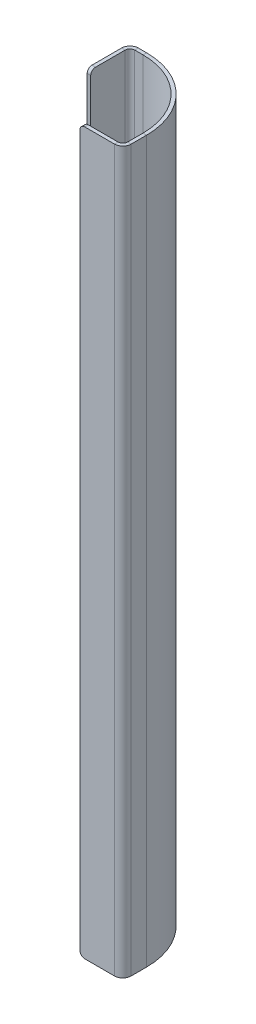
from build123d import *

# Parameters (mm, degrees)
SKETCH_8_W              = 3.5
SKETCH_8_H              = 303
SM_BASE_FLANGE_3_DEPTH  = 1.5
SM_EDGE_FLANGE_4_DEPTH  = 303
SM_EDGE_FLANGE_9_DEPTH  = 303
SM_EDGE_FLANGE_10_DEPTH = 303
FILLET_1_R              = 2


# Sheet-metal steps are written as plain solids
with BuildPart() as part:
    # Эскиз8 → Базовая кромка3 (new body)
    with BuildSketch(Plane.XY):
        with Locations((1.75, 151.5)):
            Rectangle(SKETCH_8_W, SKETCH_8_H)
    extrude(amount=-SM_BASE_FLANGE_3_DEPTH)

    # Ребро-кромка4 section (across the edge) → Ребро-кромка4 (add)
    with BuildSketch(Plane(origin=(32, 0, 0), x_dir=(-1, 0, 0), z_dir=(0, 1, 0))):
        with BuildLine():
            Line((-1.5, 28.5), (-1.5, 35))
            Line((-1.5, 35), (0, 35))
            Line((0, 35), (0, 28.5))
            ThreePointArc((0, 28.5), (8.347456736, 8.347456736), (28.5, 0))
            Line((28.5, 0), (28.5, -1.5))
            ThreePointArc((28.5, -1.5), (7.286796564, 7.286796564), (-1.5, 28.5))
        make_face()
    extrude(amount=SM_EDGE_FLANGE_4_DEPTH)

    # Ребро-кромка9 section (across the edge) → Ребро-кромка9 (add)
    with BuildSketch(Plane(origin=(-2, 303, 0), x_dir=(1, 0, 0), z_dir=(0, -1, 0))):
        with BuildLine():
            Line((-1.5, 2), (-1.5, 16.5))
            Line((-1.5, 16.5), (0, 16.5))
            Line((0, 16.5), (0, 2))
            ThreePointArc((0, 2), (0.585786438, 0.585786438), (2, 0))
            Line((2, 0), (2, -1.5))
            ThreePointArc((2, -1.5), (-0.474873734, -0.474873734), (-1.5, 2))
        make_face()
    extrude(amount=SM_EDGE_FLANGE_9_DEPTH)

    # Ребро-кромка10 section (across the edge) → Ребро-кромка10 (add)
    with BuildSketch(Plane(origin=(32, 0, 37), x_dir=(0, 0, -1), z_dir=(0, 1, 0))):
        with BuildLine():
            Line((-1.5, 2), (-1.5, 16.5))
            Line((-1.5, 16.5), (0, 16.5))
            Line((0, 16.5), (0, 2))
            ThreePointArc((0, 2), (0.585786438, 0.585786438), (2, 0))
            Line((2, 0), (2, -1.5))
            ThreePointArc((2, -1.5), (-0.474873734, -0.474873734), (-1.5, 2))
        make_face()
    extrude(amount=SM_EDGE_FLANGE_10_DEPTH)

    # Скругление1
    fillet_1_edges = [part.edges().sort_by_distance(p)[0] for p in [
        (-2.75, 303, 16.5),
        (-2.75, 0, 16.5),
        (15.5, 0, 37.75),
        (15.5, 303, 37.75),
    ]]
    fillet(fillet_1_edges, radius=FILLET_1_R)


solid = part.part
